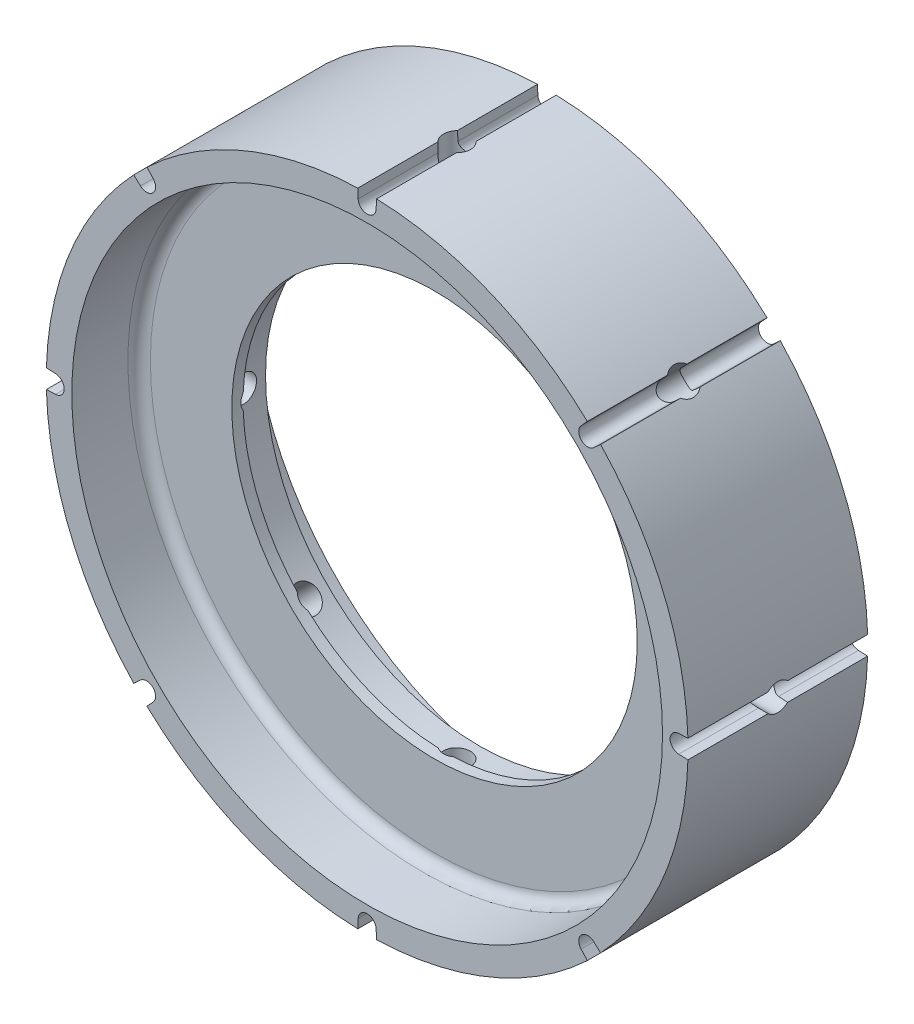
from build123d import *

# Parameters (mm, degrees)
SKETCH1_R           = 14.2875
SKETCH1_R_2         = 13.15
BOSS_EXTRUDE1_DEPTH = 3
BOSS_EXTRUDE2_START = 2
SKETCH2_R           = 14.2875
SKETCH2_R_2         = 9.025
BOSS_EXTRUDE2_DEPTH = 2
BOSS_EXTRUDE3_START = 3
SKETCH3_R           = 14.2875
SKETCH3_R_2         = 13.15
BOSS_EXTRUDE3_DEPTH = 3
FILLET1_R           = 0.5
SKETCH4_R           = 9.525
CUT_EXTRUDE2_DEPTH  = 1.5
CUT_EXTRUDE4_DEPTH  = 22.731666123
SKETCH6_R           = 0.6
CUT_EXTRUDE5_DEPTH  = 10
CIRPATTERN1_COUNT   = 8


with BuildPart() as part:
    # Sketch1 → Boss-Extrude1 (new body)
    with BuildSketch(Plane.XY):
        Circle(SKETCH1_R)
        Circle(SKETCH1_R_2, mode=Mode.SUBTRACT)
    extrude(amount=-BOSS_EXTRUDE1_DEPTH)

    # Sketch2 → Boss-Extrude2 (add)
    with BuildSketch(Plane.XY.offset(BOSS_EXTRUDE2_START)):
        Circle(SKETCH2_R)
        Circle(SKETCH2_R_2, mode=Mode.SUBTRACT)
    extrude(amount=-BOSS_EXTRUDE2_DEPTH)

    # Sketch3 → Boss-Extrude3 (add)
    with BuildSketch(Plane.XY.offset(2).offset(BOSS_EXTRUDE3_START)):
        Circle(SKETCH3_R)
        Circle(SKETCH3_R_2, mode=Mode.SUBTRACT)
    extrude(amount=-BOSS_EXTRUDE3_DEPTH)

    # Fillet1
    fillet1_edges = [part.edges().sort_by_distance(p)[0] for p in [
        (-13.15, 0, 2),
        (-13.15, 0, 0),
    ]]
    fillet(fillet1_edges, radius=FILLET1_R)

    # Sketch4 → Cut-Extrude2 (cut)
    with BuildSketch(Plane(origin=(0, 0, 0), x_dir=(-1, 0, 0), z_dir=(0, 0, -1))):
        Circle(SKETCH4_R)
    extrude(amount=-CUT_EXTRUDE2_DEPTH, mode=Mode.SUBTRACT)

    # Sketch5 → Cut-Extrude4 (cut, through all)
    with BuildSketch(Plane(origin=(0, 0, -3), x_dir=(-1, 0, 0), z_dir=(0, 0, -1))):
        with BuildLine():
            ThreePointArc((-14.281422414, 0.416689427), (-14.2875, 0), (-14.281422414, -0.416689427))
            Line((-14.281422414, -0.416689427), (-13.870916856, -0.399656101))
            ThreePointArc((-13.870916856, -0.399656101), (-13.4875, 0), (-13.870916856, 0.399656101))
            Line((-13.870916856, 0.399656101), (-14.281422414, 0.416689427))
        make_face()
    cut_extrude4 = extrude(amount=-CUT_EXTRUDE4_DEPTH, mode=Mode.SUBTRACT)

    # Sketch6 → Cut-Extrude5 (cut)
    with BuildSketch(Plane(origin=(14.281422414, 0, 0), x_dir=(0, 0, -1), z_dir=(1, 0, 0))):
        with Locations((-1, 0)):
            Circle(SKETCH6_R)
    cut_extrude5 = extrude(amount=-CUT_EXTRUDE5_DEPTH, mode=Mode.SUBTRACT)

    # CirPattern1: Cut-Extrude4, Cut-Extrude5 ×8 about axis
    cirpattern1_axis = Axis((0, 0, 0), (0, 0, -1))
    add([cut_extrude4.rotate(cirpattern1_axis, i * 360 / CIRPATTERN1_COUNT) for i in range(1, CIRPATTERN1_COUNT)], mode=Mode.SUBTRACT)
    add([cut_extrude5.rotate(cirpattern1_axis, i * 360 / CIRPATTERN1_COUNT) for i in range(1, CIRPATTERN1_COUNT)], mode=Mode.SUBTRACT)


solid = part.part
